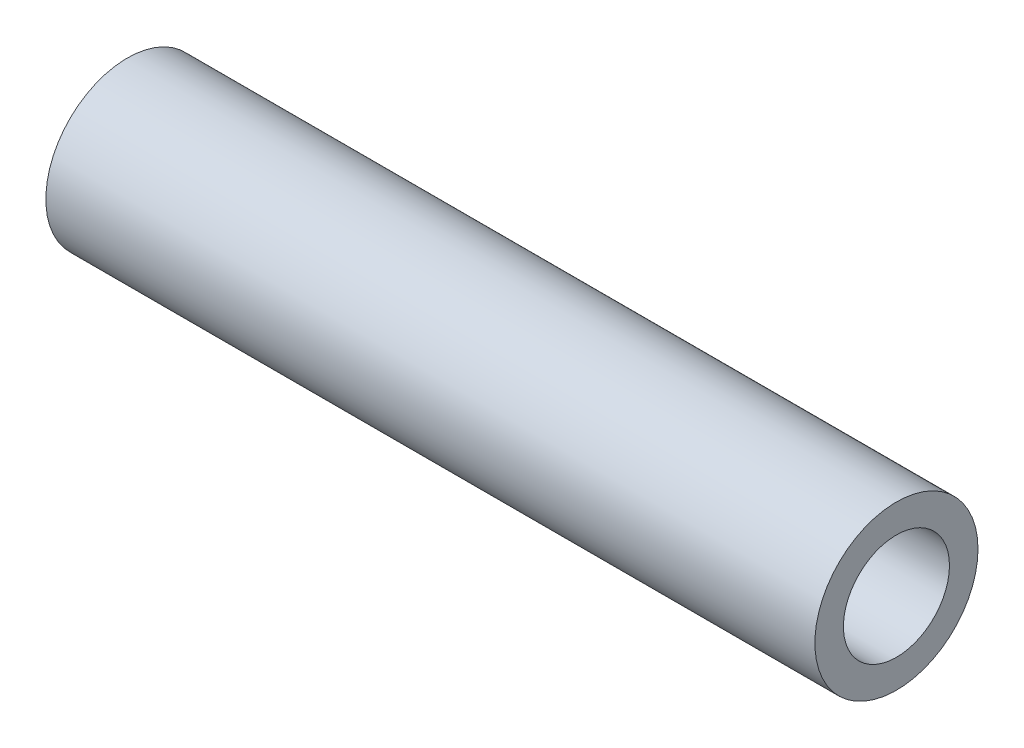
from build123d import *

# Parameters (mm, degrees)
SKETCH1_R           = 3.5
SKETCH1_R_2         = 2.275
BOSS_EXTRUDE1_DEPTH = 33


with BuildPart() as part:
    # Sketch1 → Boss-Extrude1 (new body)
    with BuildSketch(Plane(origin=(0, 0, 0), x_dir=(0, 0, -1), z_dir=(1, 0, 0))):
        Circle(SKETCH1_R)
        Circle(SKETCH1_R_2, mode=Mode.SUBTRACT)
    extrude(amount=BOSS_EXTRUDE1_DEPTH)


solid = part.part
